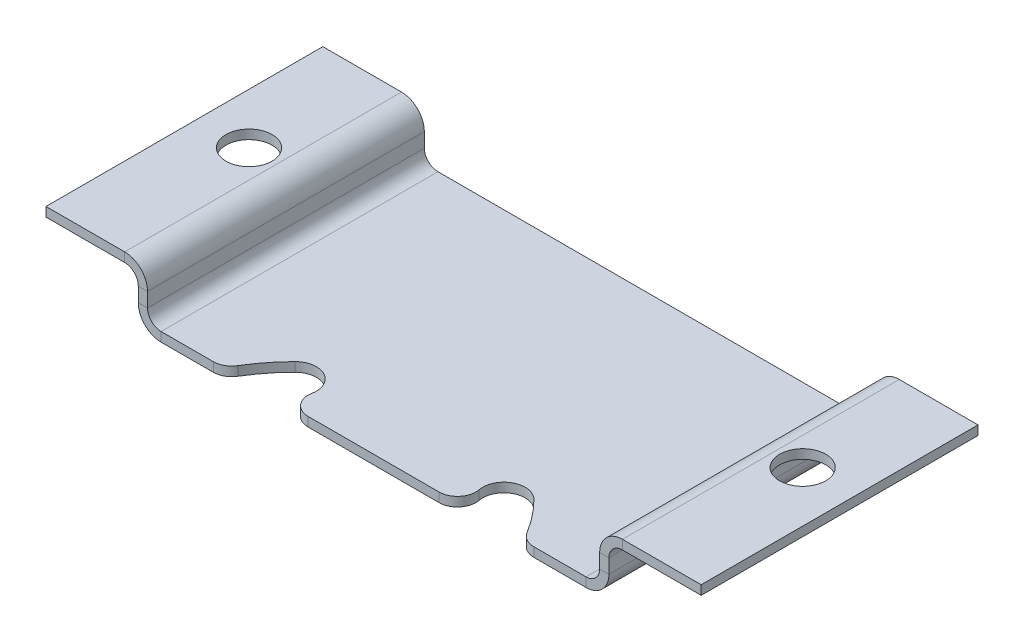
from build123d import *

# Parameters (mm, degrees)
BASE_FLANGE1_DEPTH = 7.5
SKETCH6_R          = 1.25
CUT_EXTRUDE1_DEPTH = 10
CUT_EXTRUDE2_DEPTH = 10
FILLET1_R          = 1


# Sheet-metal steps are written as plain solids
with BuildPart() as part:
    # Base-Flange1: sheet metal written as solids
    # Sketch1 → Base-Flange1 (new, symmetric)
    with BuildSketch(Plane.XY):
        with BuildLine():
            Line((-17.75, 2.75), (-13.4866, 2.75))
            ThreePointArc((-13.4866, 2.75), (-12.965745145, 2.534254855), (-12.75, 2.0134))
            Line((-12.75, 2.0134), (-12.75, 1.2366))
            ThreePointArc((-12.75, 1.2366), (-12.387808246, 0.362191754), (-11.5134, 0))
            Line((-11.5134, 0), (11.5134, 0))
            ThreePointArc((11.5134, 0), (12.387808246, 0.362191754), (12.75, 1.2366))
            Line((12.75, 1.2366), (12.75, 2.0134))
            ThreePointArc((12.75, 2.0134), (12.965745145, 2.534254855), (13.4866, 2.75))
            Line((13.4866, 2.75), (17.75, 2.75))
            Line((17.75, 2.75), (17.75, 3.25))
            Line((17.75, 3.25), (13.4866, 3.25))
            ThreePointArc((13.4866, 3.25), (12.612191754, 2.887808246), (12.25, 2.0134))
            Line((12.25, 2.0134), (12.25, 1.2366))
            ThreePointArc((12.25, 1.2366), (12.034254855, 0.715745145), (11.5134, 0.5))
            Line((11.5134, 0.5), (-11.5134, 0.5))
            ThreePointArc((-11.5134, 0.5), (-12.034254855, 0.715745145), (-12.25, 1.2366))
            Line((-12.25, 1.2366), (-12.25, 2.0134))
            ThreePointArc((-12.25, 2.0134), (-12.612191754, 2.887808246), (-13.4866, 3.25))
            Line((-13.4866, 3.25), (-17.75, 3.25))
            Line((-17.75, 3.25), (-17.75, 2.75))
        make_face()
    extrude(amount=BASE_FLANGE1_DEPTH, both=True)

    # Sketch6 → Cut-Extrude1 (cut)
    with BuildSketch(Plane.XZ.offset(-2.75)):
        with Locations(Location((-15, -0.75, 0), (0, 0, 270))):
            Circle(SKETCH6_R)
        with Locations(Location((15, -0.75, 0), (0, 0, 270))):
            Circle(SKETCH6_R)
    extrude(amount=-CUT_EXTRUDE1_DEPTH, mode=Mode.SUBTRACT)

    # Sketch7 → Cut-Extrude2 (cut)
    with BuildSketch(Plane.XZ):
        with BuildLine():
            ThreePointArc((-6.470027047, 5.279972953), (-4.843681451, 5.279972953), (-4.843681451, 6.906318549))
            ThreePointArc((-4.843681451, 6.906318549), (0, 18.599999999), (4.843681451, 6.906318549))
            ThreePointArc((4.843681451, 6.906318549), (4.843681451, 5.279972953), (6.470027047, 5.279972953))
            ThreePointArc((6.470027047, 5.279972953), (0, 20.899999999), (-6.470027047, 5.279972953))
        make_face()
    extrude(amount=-CUT_EXTRUDE2_DEPTH, mode=Mode.SUBTRACT)

    # Fillet1
    fillet1_edges = [part.edges().sort_by_distance(p)[0] for p in [
        (8.103085831, 0.25, 7.5),
        (-8.103085831, 0.25, 7.5),
        (-5.372150407, 0.25, 7.5),
        (5.372150407, 0.25, 7.5),
    ]]
    fillet(fillet1_edges, radius=FILLET1_R)


solid = part.part
